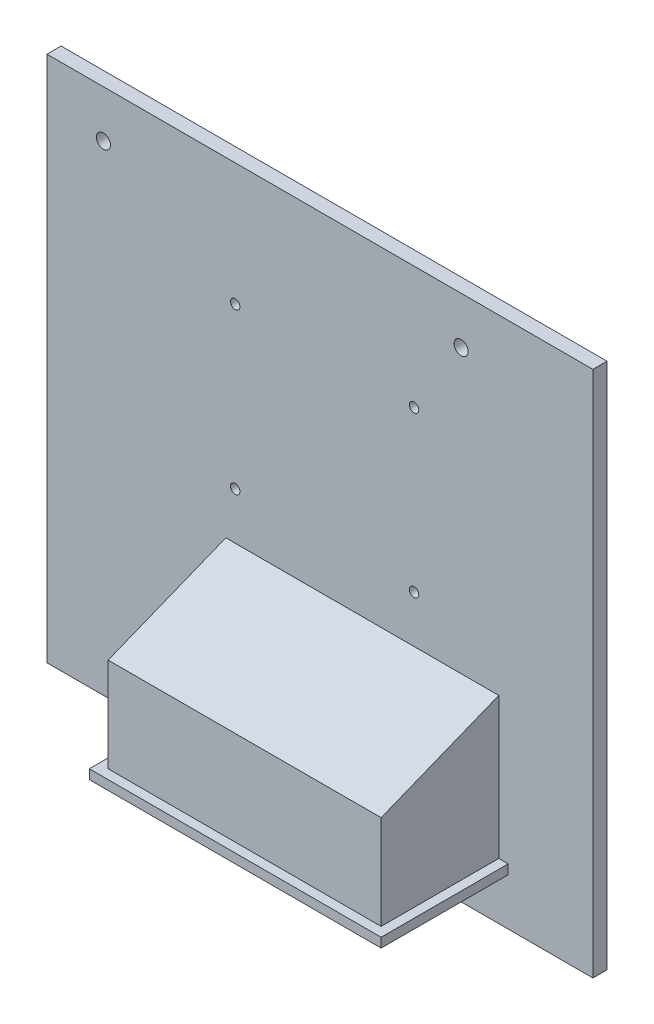
from build123d import *

# Parameters (mm, degrees)
SKETCH1_W           = 116
SKETCH1_H           = 112
BOSS_EXTRUDE1_DEPTH = 3
SKETCH2_W           = 58
SKETCH2_H           = 34
BOSS_EXTRUDE2_DEPTH = 25
CHAMFER1_SIZE2      = 10
CHAMFER1_SIZE       = 25
BOSS_EXTRUDE4_DEPTH = 2
CUT_EXTRUDE1_REACH  = 87.024
SKETCH5_R           = 1.5
CUT_EXTRUDE2_REACH  = 87.024
SKETCH6_R           = 1


with BuildPart() as part:
    # Sketch1 → Boss-Extrude1 (new body)
    with BuildSketch(Plane.XY):
        Rectangle(SKETCH1_W, SKETCH1_H)
    extrude(amount=BOSS_EXTRUDE1_DEPTH)

    # Sketch2 → Boss-Extrude2 (add)
    with BuildSketch(Plane.XY.offset(3)):
        with Locations((9, -31)):
            Rectangle(SKETCH2_W, SKETCH2_H)
    extrude(amount=BOSS_EXTRUDE2_DEPTH)

    # Chamfer1
    chamfer1_edges = [part.edges().sort_by_distance(p)[0] for p in [
        (9, -14, 28),
    ]]
    chamfer1_side = [part.faces().sort_by_distance(p)[0] for p in [
        (9, -14, 27.8),
    ]]
    chamfer(chamfer1_edges, length=CHAMFER1_SIZE - 0.0001, length2=CHAMFER1_SIZE2 - 0.0001, reference=chamfer1_side[0])  # a hair under: the kernel refuses the full size

    # Sketch4 → Boss-Extrude4 (add)
    with BuildSketch(Plane(origin=(0, -46, 0), x_dir=(-1, 0, 0), z_dir=(0, -1, 0))):
        Polygon((22, -3), (20, -3), (20, -28), (-38, -28), (-38, -3), (-40, -3), (-40, -30), (22, -30), align=None)
    extrude(amount=-BOSS_EXTRUDE4_DEPTH)

    # Sketch5 → Cut-Extrude1 (cut, up to next)
    with BuildSketch(Plane.XY.offset(3), mode=Mode.PRIVATE) as cut_extrude1_sk1:
        with Locations((-46, 46)):
            Circle(SKETCH5_R)
    cut_extrude1_tool1 = extrude(cut_extrude1_sk1.sketch, amount=-CUT_EXTRUDE1_REACH, mode=Mode.PRIVATE) & part.part
    # Sketch5 → Cut-Extrude1 (cut, up to next)
    with BuildSketch(Plane.XY.offset(3), mode=Mode.PRIVATE) as cut_extrude1_sk2:
        with Locations((30, 46)):
            Circle(SKETCH5_R)
    cut_extrude1_tool2 = extrude(cut_extrude1_sk2.sketch, amount=-CUT_EXTRUDE1_REACH, mode=Mode.PRIVATE) & part.part
    # Sketch5 → Cut-Extrude1 (cut, up to next)
    with BuildSketch(Plane.XY.offset(3), mode=Mode.PRIVATE) as cut_extrude1_sk3:
        with Locations((-36, -46)):
            Circle(SKETCH5_R)
    cut_extrude1_tool3 = extrude(cut_extrude1_sk3.sketch, amount=-CUT_EXTRUDE1_REACH, mode=Mode.PRIVATE) & part.part
    add(cut_extrude1_tool1.solids().sort_by_distance((-46, 46, 3))[0], mode=Mode.SUBTRACT)
    add(cut_extrude1_tool2.solids().sort_by_distance((30, 46, 3))[0], mode=Mode.SUBTRACT)
    add(cut_extrude1_tool3.solids().sort_by_distance((-36, -46, 3))[0], mode=Mode.SUBTRACT)

    # Sketch6 → Cut-Extrude2 (cut, up to next)
    with BuildSketch(Plane.XY.offset(3), mode=Mode.PRIVATE) as cut_extrude2_sk1:
        with Locations((-18, 30)):
            Circle(SKETCH6_R)
    cut_extrude2_tool1 = extrude(cut_extrude2_sk1.sketch, amount=-CUT_EXTRUDE2_REACH, mode=Mode.PRIVATE) & part.part
    # Sketch6 → Cut-Extrude2 (cut, up to next)
    with BuildSketch(Plane.XY.offset(3), mode=Mode.PRIVATE) as cut_extrude2_sk2:
        with Locations((20, 30)):
            Circle(SKETCH6_R)
    cut_extrude2_tool2 = extrude(cut_extrude2_sk2.sketch, amount=-CUT_EXTRUDE2_REACH, mode=Mode.PRIVATE) & part.part
    # Sketch6 → Cut-Extrude2 (cut, up to next)
    with BuildSketch(Plane.XY.offset(3), mode=Mode.PRIVATE) as cut_extrude2_sk3:
        with Locations((-18, -4)):
            Circle(SKETCH6_R)
    cut_extrude2_tool3 = extrude(cut_extrude2_sk3.sketch, amount=-CUT_EXTRUDE2_REACH, mode=Mode.PRIVATE) & part.part
    # Sketch6 → Cut-Extrude2 (cut, up to next)
    with BuildSketch(Plane.XY.offset(3), mode=Mode.PRIVATE) as cut_extrude2_sk4:
        with Locations((20, -4)):
            Circle(SKETCH6_R)
    cut_extrude2_tool4 = extrude(cut_extrude2_sk4.sketch, amount=-CUT_EXTRUDE2_REACH, mode=Mode.PRIVATE) & part.part
    add(cut_extrude2_tool1.solids().sort_by_distance((-18, 30, 3))[0], mode=Mode.SUBTRACT)
    add(cut_extrude2_tool2.solids().sort_by_distance((20, 30, 3))[0], mode=Mode.SUBTRACT)
    add(cut_extrude2_tool3.solids().sort_by_distance((-18, -4, 3))[0], mode=Mode.SUBTRACT)
    add(cut_extrude2_tool4.solids().sort_by_distance((20, -4, 3))[0], mode=Mode.SUBTRACT)


solid = part.part
